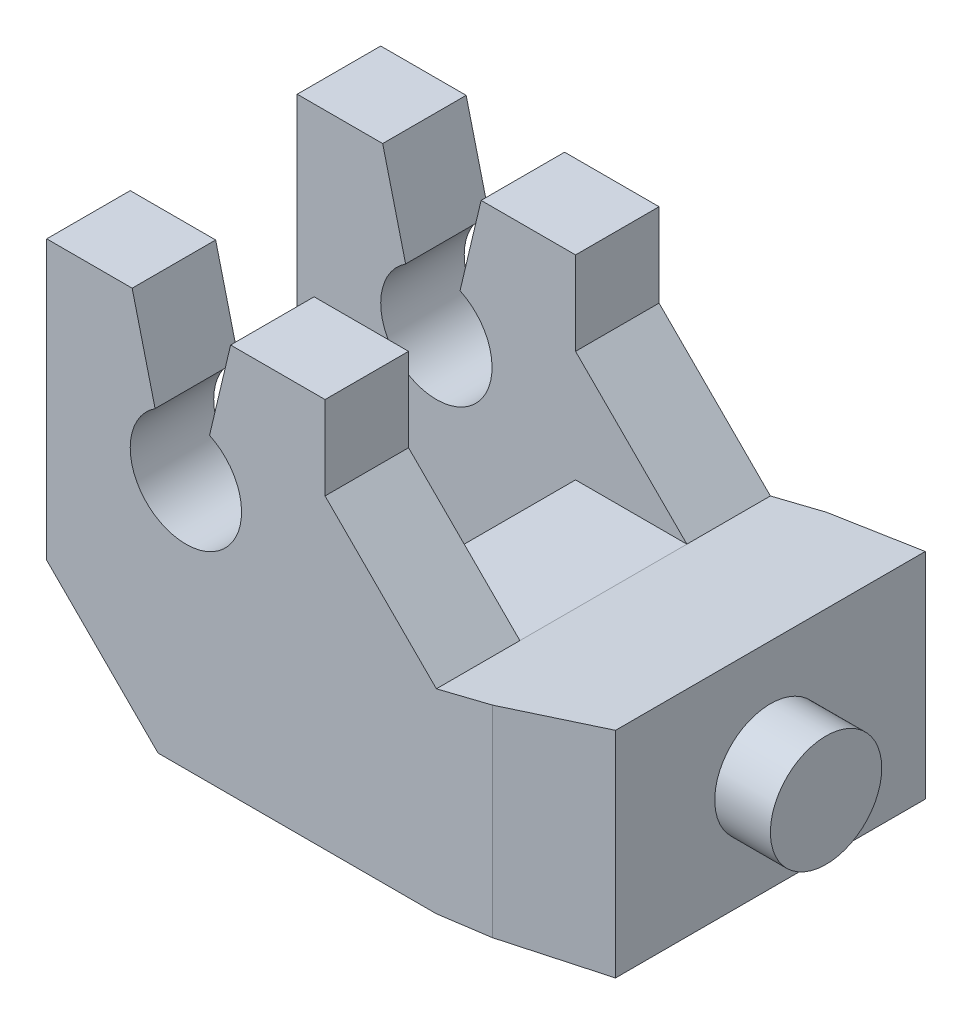
from build123d import *

# Parameters (mm, degrees)
SKETCH1_R               = 10
BOSS_EXTRUDE2_DEPTH     = 30
SKETCH4_R               = 10
CUT_EXTRUDE1_DEPTH      = 15
CHAMFER1_SIZE           = 20
CUT_EXTRUDE2_DEPTH      = 174.638139858
CUT_EXTRUDE2_DEPTH_BACK = 174.638139858
BOSS_EXTRUDE3_DEPTH     = 45
CUT_EXTRUDE3_DEPTH      = 198.547978004
CUT_EXTRUDE3_DEPTH_BACK = 15
SKETCH6_3_R             = 9
SKETCH8_W               = 15
SKETCH8_H               = 36
BOSS_EXTRUDE4_DEPTH     = 45.000002
SKETCH10_R              = 9
CUT_EXTRUDE4_DEPTH      = 198.547978004
BOSS_EXTRUDE5_DEPTH     = 10
CHAMFER2_SIZE           = 12
CUT_EXTRUDE5_DEPTH      = 40
CUT_EXTRUDE6_DEPTH      = 217.852953896
CUT_EXTRUDE6_DEPTH_BACK = 217.852953896
SKETCH14_OUTSIDE_W      = 287.488
SKETCH14_OUTSIDE_H      = 112.488
SKETCH14_OUTSIDE_W_2    = 100
SKETCH14_OUTSIDE_H_2    = 60
SKETCH15_R              = 10
BOSS_EXTRUDE6_DEPTH     = 10
CUT_EXTRUDE7_REACH      = 115.359


# Some blends are built 0.0001 mm under size
with BuildPart() as part:
    # Sketch1 → Boss-Extrude2 (new, symmetric)
    # profile 1 of 3: a face of its own
    with BuildSketch(Plane.XY):
        Polygon((25, -10), (-4.997737685, -45.002262315), (-25, -25), (-25, 25), (25, 25), align=None)
        Circle(SKETCH1_R, mode=Mode.SUBTRACT)
    # profile 2 of 3: a face of its own
    with BuildSketch(Plane.XY):
        Polygon((45, -10), (25, -10), (-4.997737685, -45.002262315), (45.002262315, -45.002262315), (75, -41.079226753), (75, -2.548159698), align=None)
    # profile 3 of 3: a face of its own
    with BuildSketch(Plane.XY):
        Polygon((130, 11.113547523), (75, -2.548159698), (75, -41.079226753), (130, -33.886452477), (165, -33.886452477), (165, 11.113547523), align=None)
    extrude(amount=BOSS_EXTRUDE2_DEPTH, both=True)

    # Sketch4 → Cut-Extrude1 (cut, symmetric)
    with BuildSketch(Plane.XY):
        Polygon((25, -10), (-4.997737685, -45.002262315), (-25, -25), (-25, 25), (25, 25), align=None)
        Circle(SKETCH4_R, mode=Mode.SUBTRACT)
    extrude(amount=CUT_EXTRUDE1_DEPTH, both=True, mode=Mode.SUBTRACT)

    # Chamfer1
    chamfer1_edges = [part.edges().sort_by_distance(p)[0] for p in [
        (25, -10, -22.5),
        (25, -10, 22.5),
    ]]
    chamfer(chamfer1_edges, length=CHAMFER1_SIZE - 0.0001)  # a hair under: the kernel refuses the full size

    # Sketch5 → Cut-Extrude2 (cut, two sides: drawn at the far end of the back side and taken through both)
    with BuildSketch(Plane(origin=(0, 0, 0), x_dir=(1, 0, 0), z_dir=(0, 1, 0)).offset(-CUT_EXTRUDE2_DEPTH_BACK)):
        Polygon((165, -30), (165, -18), (55.074227224, -30), align=None)
        Polygon((165, 18), (165, 30), (55.074227224, 30), align=None)
    extrude(amount=CUT_EXTRUDE2_DEPTH + CUT_EXTRUDE2_DEPTH_BACK, mode=Mode.SUBTRACT)

    # Sketch6 → Boss-Extrude3 (add)
    with BuildSketch(Plane(origin=(165, 0, 0), x_dir=(0, 0, -1), z_dir=(1, 0, 0))):
        with BuildLine():
            Line((-18, -33.886452477), (18, -33.886452477))
            Line((18, -33.886452477), (18, -17.886452477))
            ThreePointArc((18, -17.886452477), (0, -25.375680921), (-18, -17.886452477))
            Line((-18, -17.886452477), (-18, -33.886452477))
        make_face()
    extrude(amount=BOSS_EXTRUDE3_DEPTH)

    # Sketch6<3> → Cut-Extrude3 (cut, two sides: drawn at the far end of the back side and taken through both)
    with BuildSketch(Plane(origin=(165, 0, 0), x_dir=(0, 0, -1), z_dir=(1, 0, 0)).offset(-CUT_EXTRUDE3_DEPTH_BACK)):
        with Locations(Location((0, -1.886452477, 0), (0, 0, 90))):
            Circle(SKETCH6_3_R)
    extrude(amount=CUT_EXTRUDE3_DEPTH + CUT_EXTRUDE3_DEPTH_BACK, mode=Mode.SUBTRACT)

    # Sketch8 → Boss-Extrude4 (add)
    with BuildSketch(Plane.XZ.offset(33.886452477)):
        with Locations((202.5, 0)):
            Rectangle(SKETCH8_W, SKETCH8_H)
    extrude(amount=-BOSS_EXTRUDE4_DEPTH)

    # Sketch10 → Cut-Extrude4 (cut, through all)
    with BuildSketch(Plane(origin=(165, 0, 0), x_dir=(0, 0, -1), z_dir=(1, 0, 0))):
        with Locations(Location((0, -1.886452477, 0), (0, 0, 90))):
            Circle(SKETCH10_R)
    extrude(amount=CUT_EXTRUDE4_DEPTH, mode=Mode.SUBTRACT)

    # Sketch11 → Boss-Extrude5 (add)
    with BuildSketch(Plane.XZ.offset(33.886452477)):
        Polygon((130, 21.82076004), (130, -21.82076004), (165, -18), (210, -18), (210, 18), (165, 18), align=None)
    extrude(amount=BOSS_EXTRUDE5_DEPTH)

    # Chamfer2
    # the kernel refuses this chamfer: 12 mm, written as the material it takes off along each edge
    with BuildSketch(Plane(origin=(130, -43.886452477, 52.680955896), x_dir=(-0.02749587661058907, 0.9996219169112965, 0), z_dir=(0, 0, -1))) as chamfer2_piece_1_section:
        Polygon((CHAMFER2_SIZE * 0.999621916911, CHAMFER2_SIZE * 0.0274958766106), (-CHAMFER2_SIZE * 0.0274958766106, CHAMFER2_SIZE * 0.999621916911), (0, 0), align=None)
    chamfer2_piece_1 = extrude(amount=105.361911791, mode=Mode.PRIVATE)
    chamfer2_piece_1 = split(chamfer2_piece_1, bisect_by=Plane(origin=(133.216907805, -33.465752628, 0), z_dir=(0.1296735244167249, -0.9915567442488328, 0)), keep=Keep.TOP, mode=Mode.PRIVATE)
    add(chamfer2_piece_1, mode=Mode.SUBTRACT)

    # Sketch13 → Cut-Extrude5 (cut)
    with BuildSketch(Plane.XY.offset(18)):
        with BuildLine():
            Line((165, -17.886452477), (195, -17.886452477))
            ThreePointArc((195, -17.886452477), (180, -25.224548687), (165, -17.886452477))
        make_face()
    extrude(amount=-CUT_EXTRUDE5_DEPTH, mode=Mode.SUBTRACT)

    # Sketch14 outside → Cut-Extrude6 (cut, two sides: drawn at the far end of the back side and taken through both)
    with BuildSketch(Plane(origin=(0, 0, 0), x_dir=(1, 0, 0), z_dir=(0, 1, 0)).offset(-CUT_EXTRUDE6_DEPTH_BACK)):
        with Locations((92.5, 0)):
            Rectangle(SKETCH14_OUTSIDE_W, SKETCH14_OUTSIDE_H)
        with Locations((25, 0)):
            Rectangle(SKETCH14_OUTSIDE_W_2, SKETCH14_OUTSIDE_H_2, mode=Mode.SUBTRACT)
    extrude(amount=CUT_EXTRUDE6_DEPTH + CUT_EXTRUDE6_DEPTH_BACK, mode=Mode.SUBTRACT)

    # Sketch15 → Boss-Extrude6 (add)
    with BuildSketch(Plane(origin=(75, 0, 0), x_dir=(0, 0, -1), z_dir=(1, 0, 0))):
        with Locations((0, -22.3255367)):
            Circle(SKETCH15_R)
    extrude(amount=BOSS_EXTRUDE6_DEPTH)

    # Cut-Extrude7: up to this face of the body (flat: up to its plane)
    cut_extrude7_end = Plane(part.part.faces().sort_by_distance((12.358249011, -13.375403826, 30))[0])
    # Sketch16 → Cut-Extrude7 (cut, up to the picked face)
    with BuildSketch(Plane(origin=(0, 0, -30), x_dir=(-1, 0, 0), z_dir=(0, 0, -1)), mode=Mode.PRIVATE) as cut_extrude7_sk1:
        with BuildLine():
            Line((-8.033000326, 25), (-4.250478251, 9.051708935))
            ThreePointArc((-4.250478251, 9.051708935), (0.734596104, 9.972981929), (5.530881389, 8.331227464))
            Line((5.530881389, 8.331227464), (9.650814715, 25))
            Line((9.650814715, 25), (-8.033000326, 25))
        make_face()
    cut_extrude7_tool1 = split(extrude(cut_extrude7_sk1.sketch, amount=-CUT_EXTRUDE7_REACH, mode=Mode.PRIVATE), bisect_by=cut_extrude7_end, keep=Keep.BOTH, mode=Mode.PRIVATE)
    add(cut_extrude7_tool1.solids().sort_by(Axis((-0.802445, 17.957811, -30), (0, 0, 1)))[0], mode=Mode.SUBTRACT)


solid = part.part
